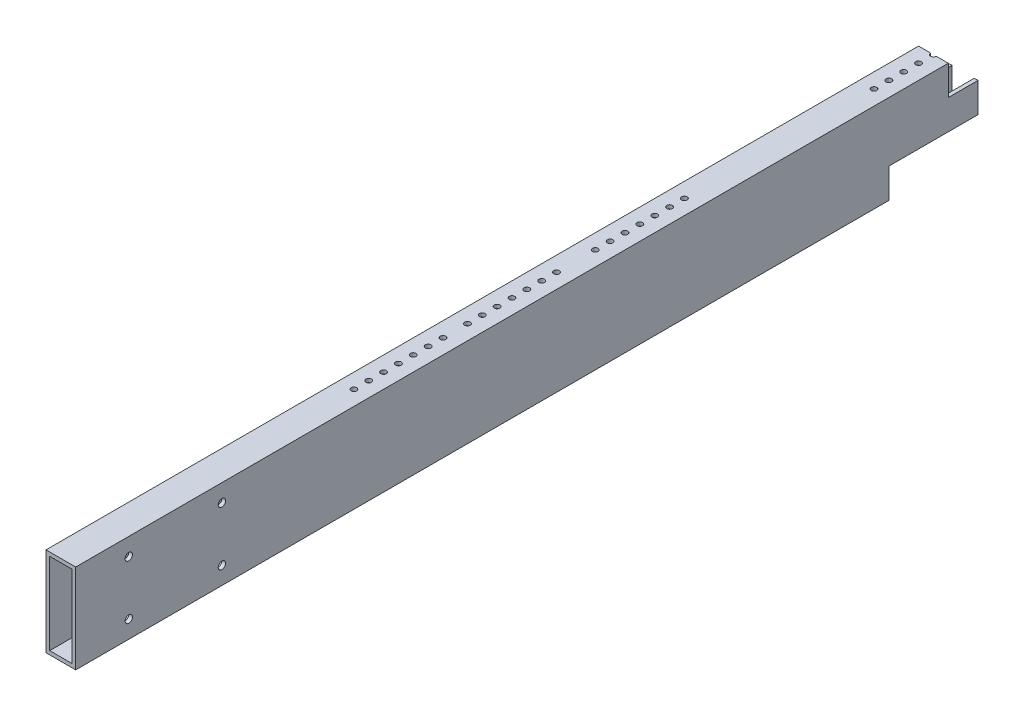
from build123d import *

# Parameters (mm, degrees)
SKETCH1_W                               = 25.4
SKETCH1_H                               = 76.2
BOSS_EXTRUDE1_DEPTH                     = 385.699
SHELL1_T                                = -3.175
SKETCH2_W                               = 76.2
SKETCH2_H                               = 25.4
CUT_EXTRUDE1_DEPTH                      = 389.407632007
SKETCH3_W                               = 25.4
SKETCH3_H                               = 25.4
CUT_EXTRUDE2_DEPTH                      = 389.407632007
SKETCH4_R                               = 2.38125
CUT_EXTRUDE3_DEPTH                      = 394.359185225
CUT_EXTRUDE4_REACH                      = 395.359
SKETCH5_R                               = 2.38125
CUT_EXTRUDE5_REACH                      = 395.359
SKETCH6_R                               = 2.38125
CBORE_FOR_M6_HEX_HEAD_BOLT1_D           = 6.3
CBORE_FOR_M6_HEX_HEAD_BOLT1_CBORE_D     = 14.547
CBORE_FOR_M6_HEX_HEAD_BOLT1_CBORE_DEPTH = 4


with BuildPart() as part:
    # Sketch1 → Boss-Extrude1 (new, symmetric)
    with BuildSketch(Plane.XY):
        Rectangle(SKETCH1_W, SKETCH1_H)
    extrude(amount=BOSS_EXTRUDE1_DEPTH, both=True)

    # Shell1
    shell1_openings = [part.faces().sort_by_distance(p)[0] for p in [
        (0, 0, -385.699),
        (0, 0, 385.699),
    ]]
    offset(amount=SHELL1_T, openings=shell1_openings, kind=Kind.INTERSECTION)

    # Sketch2 → Cut-Extrude1 (cut, through all)
    with BuildSketch(Plane(origin=(12.7, 0, 0), x_dir=(0, 0, -1), z_dir=(1, 0, 0))):
        with Locations((347.599, -25.4)):
            Rectangle(SKETCH2_W, SKETCH2_H)
    extrude(amount=-CUT_EXTRUDE1_DEPTH, mode=Mode.SUBTRACT)

    # Sketch3 → Cut-Extrude2 (cut, through all)
    with BuildSketch(Plane(origin=(12.7, 0, 0), x_dir=(0, 0, -1), z_dir=(1, 0, 0))):
        with Locations((372.999, 25.4)):
            Rectangle(SKETCH3_W, SKETCH3_H)
    extrude(amount=-CUT_EXTRUDE2_DEPTH, mode=Mode.SUBTRACT)

    # Sketch4 → Cut-Extrude3 (cut, through all)
    with BuildSketch(Plane(origin=(0, 38.1, 0), x_dir=(1, 0, 0), z_dir=(0, 1, 0))):
        with Locations((0, 147.394483214)):
            Circle(SKETCH4_R)
        with Locations((0, 134.694483214)):
            Circle(SKETCH4_R)
        with Locations((0, 121.994483214)):
            Circle(SKETCH4_R)
        with Locations((0, 109.294483214)):
            Circle(SKETCH4_R)
        with Locations((0, 96.594483214)):
            Circle(SKETCH4_R)
        with Locations((0, 83.894483214)):
            Circle(SKETCH4_R)
        with Locations((0, 71.194483214)):
            Circle(SKETCH4_R)
        with Locations((0, 38.09873)):
            Circle(SKETCH4_R)
        with Locations((0, 25.39873)):
            Circle(SKETCH4_R)
        with Locations((0, 12.69873)):
            Circle(SKETCH4_R)
        with Locations((0, -0.00127)):
            Circle(SKETCH4_R)
        with Locations((0, -12.70127)):
            Circle(SKETCH4_R)
        with Locations((0, -25.40127)):
            Circle(SKETCH4_R)
        with Locations((0, -38.10127)):
            Circle(SKETCH4_R)
        with Locations((0, -58.99324371)):
            Circle(SKETCH4_R)
        with Locations((0, -71.69324371)):
            Circle(SKETCH4_R)
        with Locations((0, -84.39324371)):
            Circle(SKETCH4_R)
        with Locations((0, -97.09324371)):
            Circle(SKETCH4_R)
        with Locations((0, -109.79324371)):
            Circle(SKETCH4_R)
        with Locations((0, -122.49324371)):
            Circle(SKETCH4_R)
        with Locations((0, -135.19324371)):
            Circle(SKETCH4_R)
    extrude(amount=-CUT_EXTRUDE3_DEPTH, mode=Mode.SUBTRACT)

    # Sketch5 → Cut-Extrude4 (cut, up to next)
    with BuildSketch(Plane(origin=(0, 38.1, 0), x_dir=(1, 0, 0), z_dir=(0, 1, 0)), mode=Mode.PRIVATE) as cut_extrude4_sk1:
        with Locations((0, 360.299)):
            Circle(SKETCH5_R)
    cut_extrude4_tool1 = extrude(cut_extrude4_sk1.sketch, amount=-CUT_EXTRUDE4_REACH, mode=Mode.PRIVATE) & part.part
    # Sketch5 → Cut-Extrude4 (cut, up to next)
    with BuildSketch(Plane(origin=(0, 38.1, 0), x_dir=(1, 0, 0), z_dir=(0, 1, 0)), mode=Mode.PRIVATE) as cut_extrude4_sk2:
        with Locations((0, 347.599)):
            Circle(SKETCH5_R)
    cut_extrude4_tool2 = extrude(cut_extrude4_sk2.sketch, amount=-CUT_EXTRUDE4_REACH, mode=Mode.PRIVATE) & part.part
    # Sketch5 → Cut-Extrude4 (cut, up to next)
    with BuildSketch(Plane(origin=(0, 38.1, 0), x_dir=(1, 0, 0), z_dir=(0, 1, 0)), mode=Mode.PRIVATE) as cut_extrude4_sk3:
        with Locations((0, 334.899)):
            Circle(SKETCH5_R)
    cut_extrude4_tool3 = extrude(cut_extrude4_sk3.sketch, amount=-CUT_EXTRUDE4_REACH, mode=Mode.PRIVATE) & part.part
    # Sketch5 → Cut-Extrude4 (cut, up to next)
    with BuildSketch(Plane(origin=(0, 38.1, 0), x_dir=(1, 0, 0), z_dir=(0, 1, 0)), mode=Mode.PRIVATE) as cut_extrude4_sk4:
        with Locations((0, 322.199)):
            Circle(SKETCH5_R)
    cut_extrude4_tool4 = extrude(cut_extrude4_sk4.sketch, amount=-CUT_EXTRUDE4_REACH, mode=Mode.PRIVATE) & part.part
    # Sketch5 → Cut-Extrude4 (cut, up to next)
    with BuildSketch(Plane(origin=(0, 38.1, 0), x_dir=(1, 0, 0), z_dir=(0, 1, 0)), mode=Mode.PRIVATE) as cut_extrude4_sk5:
        with Locations((0, 309.499)):
            Circle(SKETCH5_R)
    cut_extrude4_tool5 = extrude(cut_extrude4_sk5.sketch, amount=-CUT_EXTRUDE4_REACH, mode=Mode.PRIVATE) & part.part
    add(cut_extrude4_tool1.solids().sort_by_distance((0, 38.1, -360.299))[0], mode=Mode.SUBTRACT)
    add(cut_extrude4_tool2.solids().sort_by_distance((0, 38.1, -347.599))[0], mode=Mode.SUBTRACT)
    add(cut_extrude4_tool3.solids().sort_by_distance((0, 38.1, -334.899))[0], mode=Mode.SUBTRACT)
    add(cut_extrude4_tool4.solids().sort_by_distance((0, 38.1, -322.199))[0], mode=Mode.SUBTRACT)
    add(cut_extrude4_tool5.solids().sort_by_distance((0, 38.1, -309.499))[0], mode=Mode.SUBTRACT)

    # Sketch6 → Cut-Extrude5 (cut, up to next)
    with BuildSketch(Plane.XZ.offset(38.1), mode=Mode.PRIVATE) as cut_extrude5_sk1:
        with Locations((0, -309.499)):
            Circle(SKETCH6_R)
    cut_extrude5_tool1 = extrude(cut_extrude5_sk1.sketch, amount=-CUT_EXTRUDE5_REACH, mode=Mode.PRIVATE) & part.part
    # Sketch6 → Cut-Extrude5 (cut, up to next)
    with BuildSketch(Plane.XZ.offset(38.1), mode=Mode.PRIVATE) as cut_extrude5_sk2:
        with Locations((0, -296.799)):
            Circle(SKETCH6_R)
    cut_extrude5_tool2 = extrude(cut_extrude5_sk2.sketch, amount=-CUT_EXTRUDE5_REACH, mode=Mode.PRIVATE) & part.part
    # Sketch6 → Cut-Extrude5 (cut, up to next)
    with BuildSketch(Plane.XZ.offset(38.1), mode=Mode.PRIVATE) as cut_extrude5_sk3:
        with Locations((0, -284.099)):
            Circle(SKETCH6_R)
    cut_extrude5_tool3 = extrude(cut_extrude5_sk3.sketch, amount=-CUT_EXTRUDE5_REACH, mode=Mode.PRIVATE) & part.part
    # Sketch6 → Cut-Extrude5 (cut, up to next)
    with BuildSketch(Plane.XZ.offset(38.1), mode=Mode.PRIVATE) as cut_extrude5_sk4:
        with Locations((0, -258.699)):
            Circle(SKETCH6_R)
    cut_extrude5_tool4 = extrude(cut_extrude5_sk4.sketch, amount=-CUT_EXTRUDE5_REACH, mode=Mode.PRIVATE) & part.part
    # Sketch6 → Cut-Extrude5 (cut, up to next)
    with BuildSketch(Plane.XZ.offset(38.1), mode=Mode.PRIVATE) as cut_extrude5_sk5:
        with Locations((0, -271.399)):
            Circle(SKETCH6_R)
    cut_extrude5_tool5 = extrude(cut_extrude5_sk5.sketch, amount=-CUT_EXTRUDE5_REACH, mode=Mode.PRIVATE) & part.part
    add(cut_extrude5_tool1.solids().sort_by_distance((0, -38.1, -309.499))[0], mode=Mode.SUBTRACT)
    add(cut_extrude5_tool2.solids().sort_by_distance((0, -38.1, -296.799))[0], mode=Mode.SUBTRACT)
    add(cut_extrude5_tool3.solids().sort_by_distance((0, -38.1, -284.099))[0], mode=Mode.SUBTRACT)
    add(cut_extrude5_tool4.solids().sort_by_distance((0, -38.1, -258.699))[0], mode=Mode.SUBTRACT)
    add(cut_extrude5_tool5.solids().sort_by_distance((0, -38.1, -271.399))[0], mode=Mode.SUBTRACT)

    # CBORE for M6 Hex Head Bolt1 (through all)
    with Locations(Plane.ZY.offset(12.7)):
        with Locations((260.7244, 23.1254), (260.7244, -23.1), (340.3244, 23.1254), (340.3244, -23.1)):
            CounterBoreHole(CBORE_FOR_M6_HEX_HEAD_BOLT1_D / 2, CBORE_FOR_M6_HEX_HEAD_BOLT1_CBORE_D / 2, CBORE_FOR_M6_HEX_HEAD_BOLT1_CBORE_DEPTH)


solid = part.part
